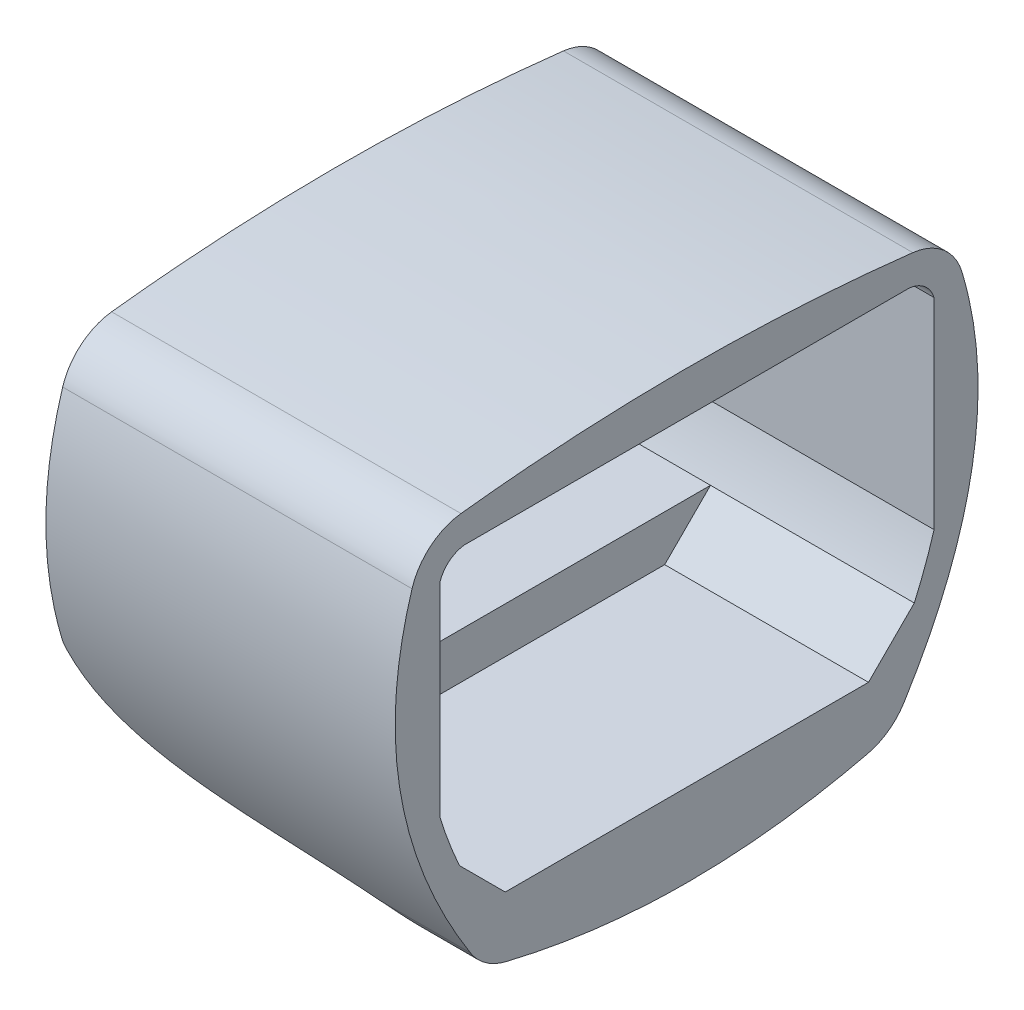
from build123d import *
from OCP.BRepAlgoAPI import BRepAlgoAPI_Cut
from OCP.TopTools import TopTools_ListOfShape

# Parameters (mm, degrees)
BOSS_EXTRUDE8_DEPTH      = 152.4
FILLET4_R                = 25.4
FILLET5_R                = 25.4
FILLET6_R                = 25.4
FILLET7_R                = 25.4
CUT_EXTRUDE16_DEPTH      = 247.514886375
CUT_EXTRUDE16_DEPTH_BACK = 247.514886375
SKETCH15_OUTSIDE_W       = 225.302
SKETCH15_OUTSIDE_H       = 267.354
CUT_EXTRUDE15_START      = -139.7
CUT_EXTRUDE15_DEPTH      = 139.7
CUT_EXTRUDE15_START_2    = -107.121047974
CUT_EXTRUDE15_2_DEPTH    = 215.583659042
FILLET10_R               = 12.7
CUT_EXTRUDE17_DEPTH      = 88.9


with BuildPart() as part:
    # Sketch8 → Boss-Extrude8 (new body)
    with BuildSketch(Plane(origin=(0, 0, 0), x_dir=(0, 0, -1), z_dir=(1, 0, 0))):
        with BuildLine():
            add(Edge.make_bspline(
                [(-89.517321988, -36.735442624), (-0.634104952, -60.975176902), (88.282437318, -37.028001665)],
                knots=[0, 0, 0, 1, 1, 1], degree=2))
            add(Edge.make_bspline(
                [(113.698608464, 137.87777005), (148.206005145, 51.814722278), (88.282437318, -37.028001665)],
                knots=[0, 0, 0, 1, 1, 1], degree=2))
            add(Edge.make_bspline(
                [(-114.901391536, 137.87777005), (-0.596034429, 153.168104446), (113.698608464, 137.87777005)],
                knots=[0, 0, 0, 1, 1, 1], degree=2))
            add(Edge.make_bspline(
                [(-114.901391536, 137.87777005), (-150.307927624, 52.141383045), (-89.517321988, -36.735442624)],
                knots=[0, 0, 0, 1, 1, 1], degree=2))
        make_face()
    extrude(amount=BOSS_EXTRUDE8_DEPTH)

    # Fillet4
    fillet4_edges = [part.edges().sort_by_distance(p)[0] for p in [
        (76.2, 137.87777005, 114.901391536),
    ]]
    fillet(fillet4_edges, radius=FILLET4_R)

    # Fillet5
    fillet5_edges = [part.edges().sort_by_distance(p)[0] for p in [
        (76.2, -36.735442624, 89.517321988),
    ]]
    fillet(fillet5_edges, radius=FILLET5_R)

    # Fillet6
    fillet6_edges = [part.edges().sort_by_distance(p)[0] for p in [
        (76.2, -37.028001665, -88.282437318),
    ]]
    fillet(fillet6_edges, radius=FILLET6_R)

    # Fillet7
    fillet7_edges = [part.edges().sort_by_distance(p)[0] for p in [
        (76.2, 137.87777005, -113.698608464),
    ]]
    fillet(fillet7_edges, radius=FILLET7_R)


with BuildPart() as cut_extrude16_tool:
    # Sketch15 outside → Cut-Extrude16 (new, two sides: drawn at the far end of the back side and taken through both)
    with BuildSketch(Plane.XY.offset(-CUT_EXTRUDE16_DEPTH_BACK)):
        with Locations((76.2, 48.297)):
            Rectangle(SKETCH15_OUTSIDE_W, SKETCH15_OUTSIDE_H)
        with BuildLine():
            Line((0, 145.522937248), (152.4, 145.522937248))
            Line((152.4, 145.522937248), (152.4, -48.92889358))
            add(Edge.make_bspline(
                [(152.4, -48.92889358), (110.926936948, -4.126097701), (19.317462744, -43.320532891), (0, 25.209390068)],
                knots=[0, 0, 0, 0, 1, 1, 1, 1], degree=3))
            Line((0, 25.209390068), (0, 145.522937248))
        make_face(mode=Mode.SUBTRACT)
    extrude(amount=CUT_EXTRUDE16_DEPTH + CUT_EXTRUDE16_DEPTH_BACK)


with BuildPart() as part_1:
    add(part.part)

    # Cut-Extrude16: cut by cut_extrude16_tool, with a tolerance
    cut_extrude16_stock = TopTools_ListOfShape()
    cut_extrude16_stock.Append(part_1.part.wrapped)
    cut_extrude16_tools = TopTools_ListOfShape()
    cut_extrude16_tools.Append(cut_extrude16_tool.part.wrapped)
    cut_extrude16_cut = BRepAlgoAPI_Cut()
    cut_extrude16_cut.SetArguments(cut_extrude16_stock)
    cut_extrude16_cut.SetTools(cut_extrude16_tools)
    cut_extrude16_cut.SetFuzzyValue(0.00001)
    cut_extrude16_cut.Build()
    add(Compound.cast(cut_extrude16_cut.Shape()).solids(), mode=Mode.REPLACE)

    # Cut-Extrude15: read off the stored shape, not the designer's step
    # Cut-Extrude15 outline → Cut-Extrude15 (cut)
    with BuildSketch(Plane(origin=(152.4, 0, 0), x_dir=(0, 0, -1), z_dir=(1, 0, 0)).offset(CUT_EXTRUDE15_START)):
        with BuildLine():
            Line((-108.462610918, 118.343948744), (-108.462610968, 29.857145502))
            add(Edge.make_bspline(
                [(-108.462610968, 29.857145502), (-108.303396792, 29.330392086), (-108.141581561, 28.80417359), (-107.065329269, 25.362622105), (-106.073914967, 22.462725385), (-103.939463928, 16.695703636), (-102.803256247, 13.846836756), (-101.052061435, 9.735706989), (-100.487342065, 8.448198791), (-99.909630865, 7.167215308)],
                knots=[0.613732154, 0.613732154, 0.613732154, 0.613732154, 0.625, 0.625, 0.6875, 0.6875, 0.75, 0.75, 0.77871627, 0.77871627, 0.77871627, 0.77871627], degree=3))
            Line((-99.909630865, 7.167215308), (98.50890353, 7.1672153))
            add(Edge.make_bspline(
                [(98.50890353, 7.1672153), (99.030702422, 8.344757297), (99.541287229, 9.526823546), (102.383358501, 16.284548345), (104.473090717, 21.957741134), (106.563539536, 28.680710786), (106.846143617, 29.616761908), (107.121047874, 30.555919476)],
                knots=[0.223373266, 0.223373266, 0.223373266, 0.223373266, 0.25, 0.25, 0.375, 0.375, 0.395143119, 0.395143119, 0.395143119, 0.395143119], degree=3))
            Line((107.121047874, 30.555919476), (107.121047874, 118.246293452))
            ThreePointArc((107.121047874, 118.246293452), (103.111414114, 124.347995452), (96.404571724, 127.233510198))
            Line((96.404571724, 127.233510198), (-97.784453574, 127.21292508))
            ThreePointArc((-97.784453574, 127.21292508), (-104.442431868, 124.366378649), (-108.462610918, 118.343948744))
        make_face()
    extrude(amount=CUT_EXTRUDE15_DEPTH, mode=Mode.SUBTRACT)

    # Cut-Extrude15 2 outline → Cut-Extrude15 2 (add)
    with BuildSketch(Plane.XY.offset(CUT_EXTRUDE15_START_2)):
        with BuildLine():
            Line((12.7, 7.167215307), (20.89442948, 7.1672153))
            add(Edge.make_bspline(
                [(20.89442948, 7.1672153), (17.477928889, 12.167382595), (14.701088569, 18.110401588), (12.7, 25.209390068)],
                knots=[0.896410383, 0.896410383, 0.896410383, 0.896410383, 1, 1, 1, 1], degree=3))
            Line((12.7, 25.209390068), (12.7, 7.167215307))
        make_face()
    extrude(amount=CUT_EXTRUDE15_2_DEPTH)

    # Fillet10
    fillet10_edges = [part_1.edges().sort_by_distance(p)[0] for p in [
        (0, 25.209390068, 60.161160898),
    ]]
    fillet(fillet10_edges, radius=FILLET10_R)

    # Sketch17 → Cut-Extrude17 (cut)
    with BuildSketch(Plane(origin=(152.4, 0, 0), x_dir=(0, 0, -1), z_dir=(1, 0, 0))):
        Polygon((-99.909630865, 7.167215308), (-79.922490142, -12.819925415), (78.521762811, -12.819925415), (98.508903533, 7.167215308), align=None)
    extrude(amount=-CUT_EXTRUDE17_DEPTH, mode=Mode.SUBTRACT)


solid = part_1.part
